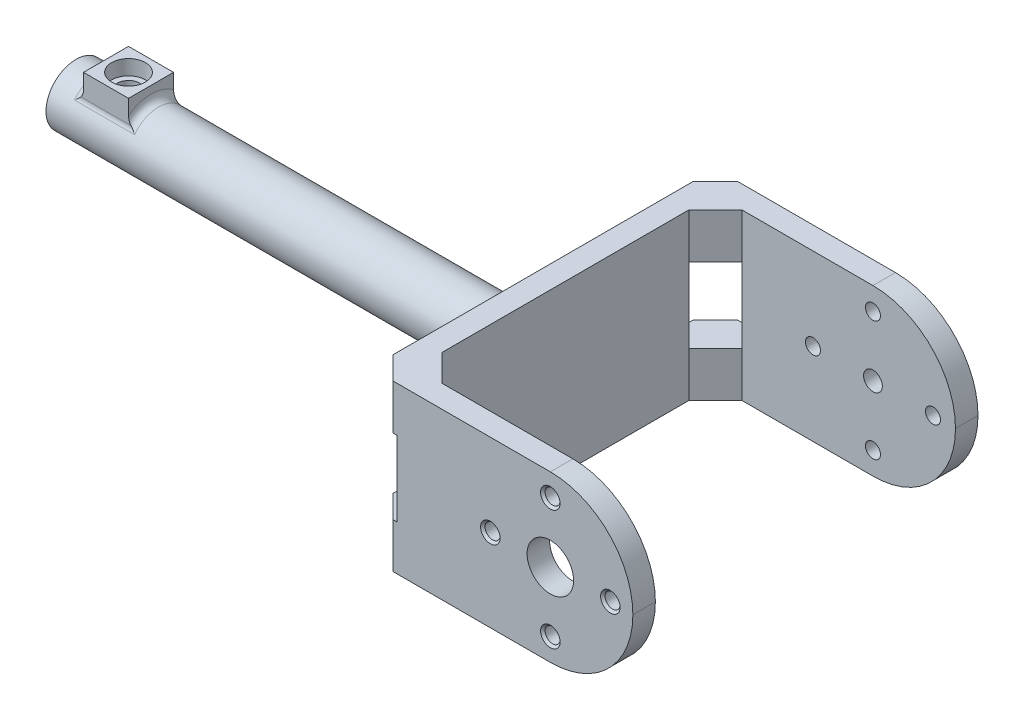
from build123d import *

# Parameters (mm, degrees)
IZIM1_W                                        = 46
IZIM1_H                                        = 22
Y_KSEKLIK_EKSTR_ZYON1_DEPTH                    = 35
IZIM2_W                                        = 40
IZIM2_H                                        = 22
KES_EKSTR_ZYON1_DEPTH                          = 32
RADYUS1_R                                      = 11
PAH1_SIZE                                      = 3
IZIM3_W                                        = 5
IZIM3_H                                        = 10
KES_EKSTR_ZYON2_DEPTH                          = 20
FEDER5_REACH                                   = 46.833
IZIM8_WALL_W                                   = 96.666047784
IZIM8_WALL_H                                   = 6
AYNALAMA4_COPY_1_REACH                         = 46.833
AYNALAMA4_COPY_1_SKETCH_W                      = 96.666047784
AYNALAMA4_COPY_1_SKETCH_H                      = 6
IZIM10_R                                       = 3.1
KES_EKSTR_ZYON4_DEPTH                          = 59.838762733
IZIM12_R                                       = 3.1
Y_KSEKLIK_EKSTR_ZYON3_DEPTH                    = 3
M3_D_Z_BA_L_MAKINE_VIDAS_IN_HAV_A1_D           = 2.5
M3_D_Z_BA_L_MAKINE_VIDAS_IN_HAV_A1_CSINK_D     = 3.1
M3_D_Z_BA_L_MAKINE_VIDAS_IN_HAV_A1_CSINK_ANGLE = 90
IZIM18_R                                       = 4
Y_KSEKLIK_EKSTR_ZYON4_DEPTH                    = 62.22
IZIM19_W                                       = 4
IZIM19_H                                       = 4
KES_EKSTR_ZYON5_DEPTH                          = 10
RADYUS2_R                                      = 1
Y_KSEKLIK_EKSTR_ZYON5_DEPTH                    = 2
Y_KSEKLIK_EKSTR_ZYON5_DEPTH_BACK               = 2
IZIM21_W                                       = 6
IZIM21_H                                       = 6
IZIM22_R                                       = 1.5
KES_EKSTR_ZYON6_DEPTH                          = 9
IZIM23_R                                       = 2.251355404
KES_EKSTR_ZYON7_DEPTH                          = 2
RADYUS3_R                                      = 1
M2_D_Z_BA_L_MAKINE_VIDAS_IN_HAV_A2_D           = 2
M2_D_Z_BA_L_MAKINE_VIDAS_IN_HAV_A2_DEPTH       = 46
M2_D_Z_BA_L_MAKINE_VIDAS_IN_HAV_A2_CSINK_D     = 4.4
M2_D_Z_BA_L_MAKINE_VIDAS_IN_HAV_A2_CSINK_ANGLE = 90
M2_D_Z_BA_L_MAKINE_VIDAS_IN_HAV_A2_TIP         = 0.600860619


# Read off the part's stored shape, not the designer's step: M2 Düz Başlı Makine Vidası İçin Havşa1
with BuildPart() as part:
    # Çizim1 → Yükseklik-Ekstrüzyon1 (new body)
    with BuildSketch(Plane(origin=(0, 0, 0), x_dir=(0, 0, -1), z_dir=(1, 0, 0))):
        Rectangle(IZIM1_W, IZIM1_H)
    extrude(amount=Y_KSEKLIK_EKSTR_ZYON1_DEPTH)

    # Çizim2 → Kes-Ekstrüzyon1 (cut)
    with BuildSketch(Plane(origin=(35, 0, 0), x_dir=(0, 0, -1), z_dir=(1, 0, 0))):
        Rectangle(IZIM2_W, IZIM2_H)
    extrude(amount=-KES_EKSTR_ZYON1_DEPTH, mode=Mode.SUBTRACT)

    # Radyus1
    radyus1_edges = [part.edges().sort_by_distance(p)[0] for p in [
        (35, -11, 21.5),
        (35, 11, 21.5),
        (35, -11, -21.5),
        (35, 11, -21.5),
    ]]
    fillet(radyus1_edges, radius=RADYUS1_R - 0.0001)  # a hair under: the kernel refuses the full size

    # Pah1
    pah1_edges = [part.edges().sort_by_distance(p)[0] for p in [
        (0, 0, 23),
        (0, 0, -23),
    ]]
    chamfer(pah1_edges, length=PAH1_SIZE)

    # Çizim3 → Kes-Ekstrüzyon2 (cut)
    with BuildSketch(Plane(origin=(-10, 0, 10), x_dir=(0.7071067811865468, 0, 0.7071067811865483), z_dir=(-0.7071067811865483, 0, 0.7071067811865468))):
        with Locations((16.262135624, 0)):
            Rectangle(IZIM3_W, IZIM3_H)
    kes_ekstr_zyon2 = extrude(amount=-KES_EKSTR_ZYON2_DEPTH, mode=Mode.SUBTRACT)

    # M2 Düz Başlı Makine Vidası İçin Havşa1 ou → M2 Düz Başlı Makine Vidası İçin Havşa1 (revolve, cut)
    with BuildSketch(Plane(origin=(24, -8, 0), x_dir=(1, 0, 0), z_dir=(0, -1, 0))):
        Polygon((0, 20), (1, 20), (1, 22.7), (1.3, 23), (0, 23), align=None)
    m2_d_z_ba_l_makine_vidas_in_hav_a1 = revolve(axis=Axis((24, -8, 0), (0, 0, 1)), mode=Mode.SUBTRACT)

    # M2 D_z Ba_l_ Makine Vidas_ _in Hav_a 2 → M2 D_z Ba_l_ Makine Vidas_ _in Hav_a1 2 (revolve, cut)
    with BuildSketch(Plane(origin=(32, 0, 0), x_dir=(1, 0, 0), z_dir=(0, -1, 0))):
        Polygon((0, 20), (1, 20), (1, 22.7), (1.3, 23), (0, 23), align=None)
    m2_d_z_ba_l_makine_vidas_in_hav_a1_2 = revolve(axis=Axis((32, 0, 0), (0, 0, 1)), mode=Mode.SUBTRACT)

    # M2 D_z Ba_l_ Makine Vidas_ _in Hav_a 3 → M2 D_z Ba_l_ Makine Vidas_ _in Hav_a1 3 (revolve, cut)
    with BuildSketch(Plane(origin=(24, 8, 0), x_dir=(1, 0, 0), z_dir=(0, -1, 0))):
        Polygon((0, 20), (1, 20), (1, 22.7), (1.3, 23), (0, 23), align=None)
    m2_d_z_ba_l_makine_vidas_in_hav_a1_3 = revolve(axis=Axis((24, 8, 0), (0, 0, 1)), mode=Mode.SUBTRACT)

    # M2 D_z Ba_l_ Makine Vidas_ _in Hav_a 4 → M2 D_z Ba_l_ Makine Vidas_ _in Hav_a1 4 (revolve, cut)
    with BuildSketch(Plane(origin=(16, 0, 0), x_dir=(1, 0, 0), z_dir=(0, -1, 0))):
        Polygon((0, 20), (1, 20), (1, 22.7), (1.3, 23), (0, 23), align=None)
    m2_d_z_ba_l_makine_vidas_in_hav_a1_4 = revolve(axis=Axis((16, 0, 0), (0, 0, 1)), mode=Mode.SUBTRACT)

    # Aynalama2: Kes-Ekstrüzyon2, M2 Düz Başlı Makine Vidası İçin Havşa1, M2 D_z Ba_l_ Makine Vidas_ _in Hav_a1 2, M2 D_z Ba_l_ Makine Vidas_ _in Hav_a1 3, M2 D_z Ba_l_ Makine Vidas_ _in Hav_a1 4 across plane
    add(kes_ekstr_zyon2.mirror(Plane.XY), mode=Mode.SUBTRACT)
    add(m2_d_z_ba_l_makine_vidas_in_hav_a1.mirror(Plane.XY), mode=Mode.SUBTRACT)
    add(m2_d_z_ba_l_makine_vidas_in_hav_a1_2.mirror(Plane.XY), mode=Mode.SUBTRACT)
    add(m2_d_z_ba_l_makine_vidas_in_hav_a1_3.mirror(Plane.XY), mode=Mode.SUBTRACT)
    add(m2_d_z_ba_l_makine_vidas_in_hav_a1_4.mirror(Plane.XY), mode=Mode.SUBTRACT)

    # Çizim8 wall → Feder5 (add, up to next)
    with BuildSketch(Plane(origin=(4.766833329, -5, -18.231299423), x_dir=(-0.706733233022, 0, 0.707480132118), z_dir=(0.707480132118, 0, 0.706733233022)), mode=Mode.PRIVATE) as feder5_sk1:
        with Locations((0, 3)):
            Rectangle(IZIM8_WALL_W, IZIM8_WALL_H)
    feder5_tool1 = extrude(feder5_sk1.sketch, amount=-FEDER5_REACH, mode=Mode.PRIVATE) - part.part
    feder5 = feder5_tool1.solids().sort_by_distance((4.766833329, -5, -18.231299423))[0]
    add(feder5)

    # Aynalama3: Feder5 across plane
    add(feder5.mirror(Plane.ZX))

    # Aynalama4: Feder5 across plane
    add(feder5.mirror(Plane.XY))

    # Aynalama4 copy 1 sketch → Aynalama4 copy 1 (add, up to next)
    with BuildSketch(Plane(origin=(4.766833329, 5, 18.231299423), x_dir=(-0.706733233022, 0, -0.707480132118), z_dir=(0.707480132118, 0, -0.706733233022)), mode=Mode.PRIVATE) as aynalama4_copy_1_sk1:
        with Locations((0, 3)):
            Rectangle(AYNALAMA4_COPY_1_SKETCH_W, AYNALAMA4_COPY_1_SKETCH_H)
    aynalama4_copy_1_tool1 = extrude(aynalama4_copy_1_sk1.sketch, amount=-AYNALAMA4_COPY_1_REACH, mode=Mode.PRIVATE) - part.part
    add(aynalama4_copy_1_tool1.solids().sort_by_distance((4.766833329, 5, 18.231299423))[0])

    # Çizim10 → Kes-Ekstrüzyon4 (cut, through all)
    with BuildSketch(Plane(origin=(0, 0, -23), x_dir=(-1, 0, 0), z_dir=(0, 0, -1))):
        with Locations(Location((-24, 0, 0), (0, 0, 90))):
            Circle(IZIM10_R)
    extrude(amount=-KES_EKSTR_ZYON4_DEPTH, mode=Mode.SUBTRACT)

    # Çizim12 → Yükseklik-Ekstrüzyon3 (add)
    with BuildSketch(Plane(origin=(0, 0, -23), x_dir=(-1, 0, 0), z_dir=(0, 0, -1))):
        with Locations(Location((-24, 0, 0), (0, 0, 90))):
            Circle(IZIM12_R)
    extrude(amount=-Y_KSEKLIK_EKSTR_ZYON3_DEPTH)

    # M3 Düz Başlı Makine Vidası İçin Havşa1 (through all)
    with Locations(Plane(origin=(24, 0, -23), x_dir=(0, -1, 0), z_dir=(0, 0, -1))):
        with Locations((0, 0)):
            CounterSinkHole(M3_D_Z_BA_L_MAKINE_VIDAS_IN_HAV_A1_D / 2, M3_D_Z_BA_L_MAKINE_VIDAS_IN_HAV_A1_CSINK_D / 2, counter_sink_angle=M3_D_Z_BA_L_MAKINE_VIDAS_IN_HAV_A1_CSINK_ANGLE)

    # Çizim18 → Yükseklik-Ekstrüzyon4 (add)
    with BuildSketch(Plane.ZY):
        with Locations(Location((0, 0, 0), (0, 0, 180))):
            Circle(IZIM18_R)
    extrude(amount=Y_KSEKLIK_EKSTR_ZYON4_DEPTH)

    # Çizim19 → Kes-Ekstrüzyon5 (cut)
    with BuildSketch(Plane.ZY.offset(62.22)):
        Rectangle(IZIM19_W, IZIM19_H)
    extrude(amount=-KES_EKSTR_ZYON5_DEPTH, mode=Mode.SUBTRACT)

    # Çizim20 → Döndür1 (revolve)
    with BuildSketch(Plane.XY, mode=Mode.PRIVATE) as d_nd_r1_sk:
        Polygon((-52.22, -1.75), (-52.22, -3.5), (-53.97, -3.5), align=None)
    revolve(d_nd_r1_sk.sketch.rotate(Axis((-62.22, 0, 0), (1, 0, 0)), 270), axis=Axis((-62.22, 0, 0), (1, 0, 0)))

    # Radyus2
    radyus2_edges = [part.edges().sort_by_distance(p)[0] for p in [
        (0, 0, 4),
    ]]
    fillet(radyus2_edges, radius=RADYUS2_R)

    # Çizim21 → Yükseklik-Ekstrüzyon5 (add, two sides: drawn at the far end of the back side and taken through both)
    with BuildSketch(Plane(origin=(0, 4, 0), x_dir=(1, 0, 0), z_dir=(0, 1, 0)).offset(-Y_KSEKLIK_EKSTR_ZYON5_DEPTH_BACK)):
        with Locations((-55.22, 0)):
            Rectangle(IZIM21_W, IZIM21_H)
    extrude(amount=Y_KSEKLIK_EKSTR_ZYON5_DEPTH + Y_KSEKLIK_EKSTR_ZYON5_DEPTH_BACK)

    # Çizim22 → Kes-Ekstrüzyon6 (cut)
    with BuildSketch(Plane(origin=(0, 6, 0), x_dir=(1, 0, 0), z_dir=(0, 1, 0))):
        with Locations(Location((-55.22, 0, 0), (0, 0, 270))):
            Circle(IZIM22_R)
    extrude(amount=-KES_EKSTR_ZYON6_DEPTH, mode=Mode.SUBTRACT)

    # Çizim23 → Kes-Ekstrüzyon7 (cut)
    with BuildSketch(Plane(origin=(0, 6, 0), x_dir=(1, 0, 0), z_dir=(0, 1, 0))):
        with Locations(Location((-55.22, 0, 0), (0, 0, 270))):
            Circle(IZIM23_R)
    extrude(amount=-KES_EKSTR_ZYON7_DEPTH, mode=Mode.SUBTRACT)

    # Radyus3
    radyus3_edges = [part.edges().sort_by_distance(p)[0] for p in [
        (-55.22, 2.645751311, 3),
        (-55.22, 2.645751311, -3),
        (-52.22, 4, 0),
        (-58.22, 4, 0),
    ]]
    fillet(radyus3_edges, radius=RADYUS3_R)

    # M2 Düz Başlı Makine Vidası İçin Havşa2
    with Locations(Plane.XZ.offset(4)):
        with Locations((-55.22, 0)):
            CounterSinkHole(M2_D_Z_BA_L_MAKINE_VIDAS_IN_HAV_A2_D / 2, M2_D_Z_BA_L_MAKINE_VIDAS_IN_HAV_A2_CSINK_D / 2, depth=M2_D_Z_BA_L_MAKINE_VIDAS_IN_HAV_A2_DEPTH, counter_sink_angle=M2_D_Z_BA_L_MAKINE_VIDAS_IN_HAV_A2_CSINK_ANGLE)
            with Locations((0, 0, -(M2_D_Z_BA_L_MAKINE_VIDAS_IN_HAV_A2_DEPTH + M2_D_Z_BA_L_MAKINE_VIDAS_IN_HAV_A2_TIP / 2))):  # 118° drill point
                Cone(0, M2_D_Z_BA_L_MAKINE_VIDAS_IN_HAV_A2_D / 2, M2_D_Z_BA_L_MAKINE_VIDAS_IN_HAV_A2_TIP, mode=Mode.SUBTRACT)


solid = part.part
